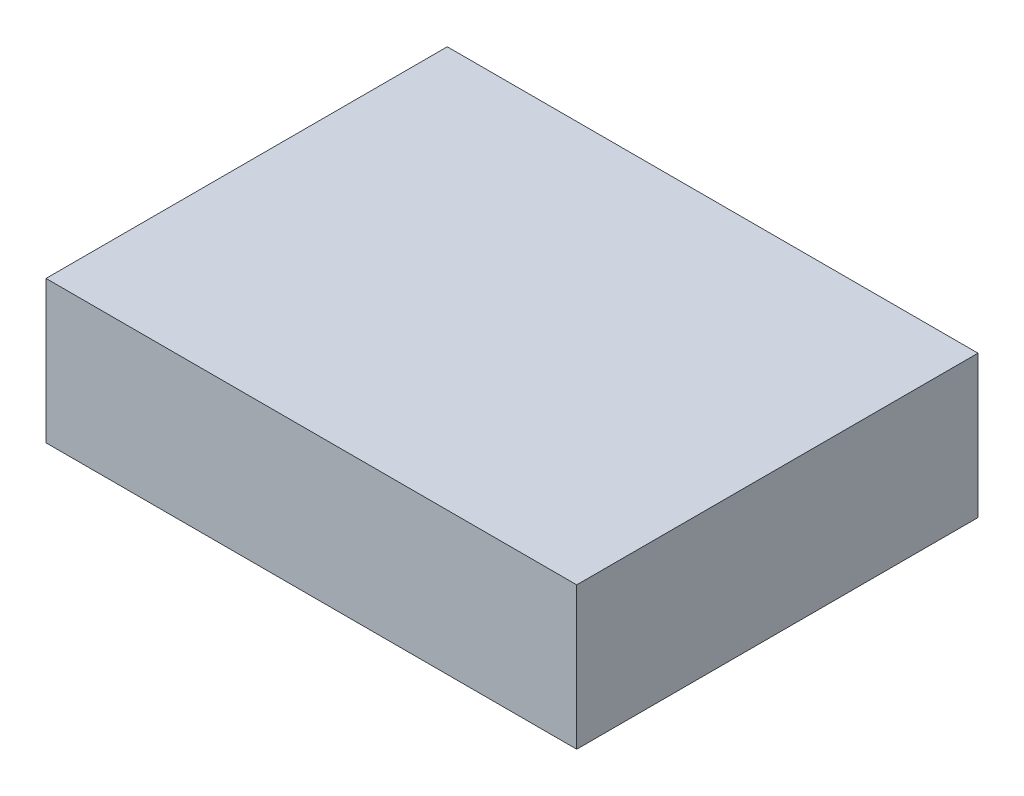
from build123d import *

# Parameters (mm, degrees)
SKETCH3_W           = 82
SKETCH3_H           = 62
BOSS_EXTRUDE2_DEPTH = 22


with BuildPart() as part:
    # Sketch3 → Boss-Extrude2 (new body)
    with BuildSketch(Plane(origin=(0, 28.929130899, 0), x_dir=(-1, 0, 0), z_dir=(0, -1, 0))):
        Rectangle(SKETCH3_W, SKETCH3_H)
    extrude(amount=-BOSS_EXTRUDE2_DEPTH)


solid = part.part
